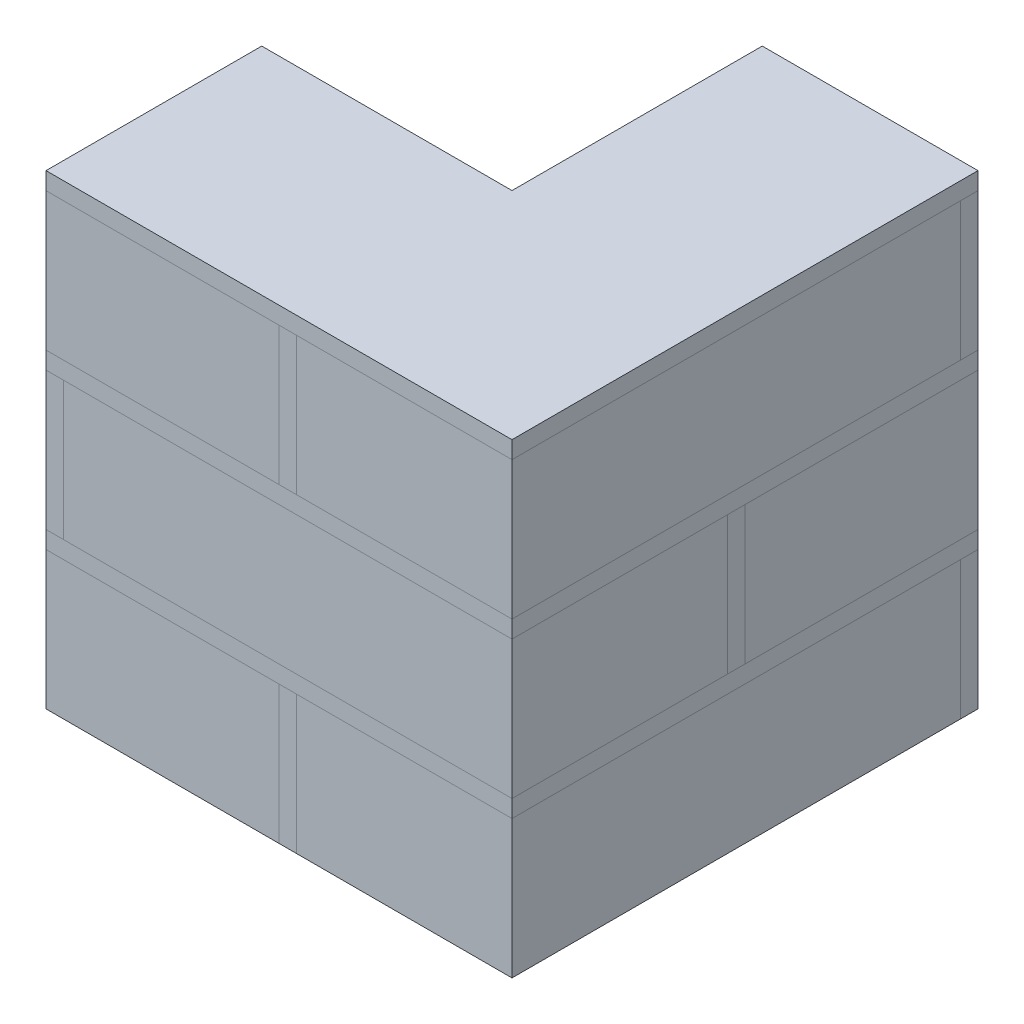
from build123d import *

# Parameters (mm, degrees)
EXTRUDE_2_DEPTH               = 7.96
SKETCH_3_W                    = 13.430057686
SKETCH_3_H                    = 13.44
EXTRUDE_2_2_DEPTH             = 7.96
SKETCH_3_3_W                  = 12.44
SKETCH_3_3_H                  = 1.000057686
EXTRUDE_3_DEPTH               = 7.96
SKETCH_3_3_W_2                = 1
SKETCH_3_3_H_2                = 13.44
EXTRUDE_3_2_DEPTH             = 7.96
SKETCH_4_W                    = 12.44
SKETCH_4_H                    = 13.43
EXTRUDE_4_DEPTH               = 7.96
EXTRUDE_4_2_DEPTH             = 7.96
SKETCH_4_4_W                  = 12.44
SKETCH_4_4_H                  = 1
EXTRUDE_5_DEPTH               = 7.96
SKETCH_4_4_W_2                = 1
SKETCH_4_4_H_2                = 12.44
EXTRUDE_5_2_DEPTH             = 7.96
EXTRUDE_8_DEPTH               = 1
PATTERN_START                 = 0.995028843
PATTERN_LINEAR_10_OUTLINE_W   = 26.870057686
PATTERN_LINEAR_10_OUTLINE_H   = 1
PATTERN_LINEAR_10_DEPTH       = 12.44
PATTERN_START_2               = -13.434971157
PATTERN_LINEAR_10_2_OUTLINE_W = 12.44
PATTERN_LINEAR_10_2_OUTLINE_H = 1
PATTERN_LINEAR_10_2_DEPTH     = 14.43
PATTERN_LINEAR_10_3_OUTLINE_W = 26.870057686
PATTERN_LINEAR_10_3_OUTLINE_H = 1
PATTERN_LINEAR_10_3_DEPTH     = 12.44
PATTERN_START_3               = -12.434971157
PATTERN_LINEAR_10_4_OUTLINE_W = 12.44
PATTERN_LINEAR_10_4_OUTLINE_H = 1
PATTERN_LINEAR_10_4_DEPTH     = 13.43
PATTERN_LINEAR_8_COUNT        = 2
PATTERN_LINEAR_8_PITCH        = 17.92


# Read off the part's stored shape, not the designer's step: Линейный массив10
with BuildPart() as part:
    # Эскиз3 → Бобышка-Вытянуть2 (new body)
    with BuildSketch(Plane(origin=(0, 0, 0), x_dir=(1, 0, 0), z_dir=(0, 1, 0))):
        Polygon((13.435028843, 12.434971157), (0.995028843, 12.434971157), (0.995028843, 0.004971157), (0.995028843, -13.435028843), (13.435028843, -13.435028843), align=None)
    extrude(amount=EXTRUDE_2_DEPTH)


with BuildPart() as body_2:
    # Эскиз3 → Extrude 2 2 (new body)
    with BuildSketch(Plane(origin=(0, 0, 0), x_dir=(1, 0, 0), z_dir=(0, 1, 0))):
        with Locations((-6.72, -6.715028843)):
            Rectangle(SKETCH_3_W, SKETCH_3_H)
    extrude(amount=EXTRUDE_2_2_DEPTH)


with BuildPart() as body_3:
    # Эскиз3<3> → Бобышка-Вытянуть3 (new body)
    with BuildSketch(Plane(origin=(0, 0, 0), x_dir=(1, 0, 0), z_dir=(0, 1, 0))):
        with Locations((7.215028843, 12.935)):
            Rectangle(SKETCH_3_3_W, SKETCH_3_3_H)
    extrude(amount=EXTRUDE_3_DEPTH)


with BuildPart() as body_4:
    # Эскиз3<3> → Extrude 3 2 (new body)
    with BuildSketch(Plane(origin=(0, 0, 0), x_dir=(1, 0, 0), z_dir=(0, 1, 0))):
        with Locations((0.495028843, -6.715028843)):
            Rectangle(SKETCH_3_3_W_2, SKETCH_3_3_H_2)
    extrude(amount=EXTRUDE_3_2_DEPTH)


with BuildPart() as body_5:
    # Эскиз4 → Бобышка-Вытянуть4 (new body)
    with BuildSketch(Plane(origin=(0, 8.96, 0), x_dir=(1, 0, 0), z_dir=(0, 1, 0))):
        with Locations((7.215028843, 6.719971157)):
            Rectangle(SKETCH_4_W, SKETCH_4_H)
    extrude(amount=EXTRUDE_4_DEPTH)


with BuildPart() as body_6:
    # Эскиз4 → Extrude 4 2 (new body)
    with BuildSketch(Plane(origin=(0, 8.96, 0), x_dir=(1, 0, 0), z_dir=(0, 1, 0))):
        Polygon((1.143114309, -0.995028843), (0.995028843, -0.995028843), (-12.435028843, -0.995028843), (-12.435028843, -13.435028843), (0.995028843, -13.435028843), (13.435028843, -13.435028843), (13.435028843, -0.995028843), align=None)
    extrude(amount=EXTRUDE_4_2_DEPTH)


with BuildPart() as body_7:
    # Эскиз4<4> → Бобышка-Вытянуть5 (new body)
    with BuildSketch(Plane(origin=(0, 8.96, 0), x_dir=(1, 0, 0), z_dir=(0, 1, 0))):
        with Locations((7.215028843, -0.495028843)):
            Rectangle(SKETCH_4_4_W, SKETCH_4_4_H)
    extrude(amount=EXTRUDE_5_DEPTH)


with BuildPart() as body_8:
    # Эскиз4<4> → Extrude 5 2 (new body)
    with BuildSketch(Plane(origin=(0, 8.96, 0), x_dir=(1, 0, 0), z_dir=(0, 1, 0))):
        with Locations((-12.935028843, -7.215028843)):
            Rectangle(SKETCH_4_4_W_2, SKETCH_4_4_H_2)
    extrude(amount=EXTRUDE_5_2_DEPTH)


with BuildPart() as body_9:
    # Эскиз5 → Бобышка-Вытянуть8 (new body)
    with BuildSketch(Plane(origin=(0, 7.96, 0), x_dir=(1, 0, 0), z_dir=(0, 1, 0))):
        Polygon((-13.435028843, -13.435028843), (0.995028843, -13.435028843), (13.435028843, -13.435028843), (13.435028843, 13.434971157), (0.995028843, 13.434971157), (0.995028843, -0.995028843), (-13.435028843, -0.995028843), align=None)
    extrude(amount=EXTRUDE_8_DEPTH)


with BuildPart() as body_10:
    # Линейный массив10 outline → Линейный массив10 (new body)
    with BuildSketch(Plane.XY.offset(PATTERN_START)):
        with Locations((0, 17.42)):
            Rectangle(PATTERN_LINEAR_10_OUTLINE_W, PATTERN_LINEAR_10_OUTLINE_H)
    extrude(amount=PATTERN_LINEAR_10_DEPTH)

    # Pattern Linear 10 2 outline → Pattern Linear 10 2 (add)
    with BuildSketch(Plane.XY.offset(PATTERN_START_2)):
        with Locations((7.215028843, 17.42)):
            Rectangle(PATTERN_LINEAR_10_2_OUTLINE_W, PATTERN_LINEAR_10_2_OUTLINE_H)
    extrude(amount=PATTERN_LINEAR_10_2_DEPTH)


with BuildPart() as body_11:
    # Pattern Linear 10 3 outline → Pattern Linear 10 3 (new body)
    with BuildSketch(Plane.XY.offset(PATTERN_START)):
        with Locations((0, 17.42)):
            Rectangle(PATTERN_LINEAR_10_3_OUTLINE_W, PATTERN_LINEAR_10_3_OUTLINE_H)
    extrude(amount=PATTERN_LINEAR_10_3_DEPTH)

    # Pattern Linear 10 4 outline → Pattern Linear 10 4 (add)
    with BuildSketch(Plane.XY.offset(PATTERN_START_3)):
        with Locations((7.215028843, 17.42)):
            Rectangle(PATTERN_LINEAR_10_4_OUTLINE_W, PATTERN_LINEAR_10_4_OUTLINE_H)
    extrude(amount=PATTERN_LINEAR_10_4_DEPTH)


with BuildPart() as pattern_linear_8_1:
    # Линейный массив8: pattern copy
    add(body_3.part.moved(Location(Vector(0, 1, 0) * (1 * PATTERN_LINEAR_8_PITCH))))


with BuildPart() as pattern_linear_8_2:
    # Линейный массив8: pattern copy
    add(body_2.part.moved(Location(Vector(0, 1, 0) * (1 * PATTERN_LINEAR_8_PITCH))))


with BuildPart() as pattern_linear_8_3:
    # Линейный массив8: pattern copy
    add(body_9.part.moved(Location(Vector(0, 1, 0) * (1 * PATTERN_LINEAR_8_PITCH))))


with BuildPart() as pattern_linear_8_4:
    # Линейный массив8: pattern copy
    add(body_4.part.moved(Location(Vector(0, 1, 0) * (1 * PATTERN_LINEAR_8_PITCH))))


with BuildPart() as pattern_linear_8_5:
    # Линейный массив8: pattern copy
    add(part.part.moved(Location(Vector(0, 1, 0) * (1 * PATTERN_LINEAR_8_PITCH))))


solid = Compound([part.part, body_2.part, body_3.part, body_4.part, body_5.part, body_6.part, body_7.part, body_8.part, body_9.part, body_10.part, body_11.part, pattern_linear_8_1.part, pattern_linear_8_2.part, pattern_linear_8_3.part, pattern_linear_8_4.part, pattern_linear_8_5.part])
